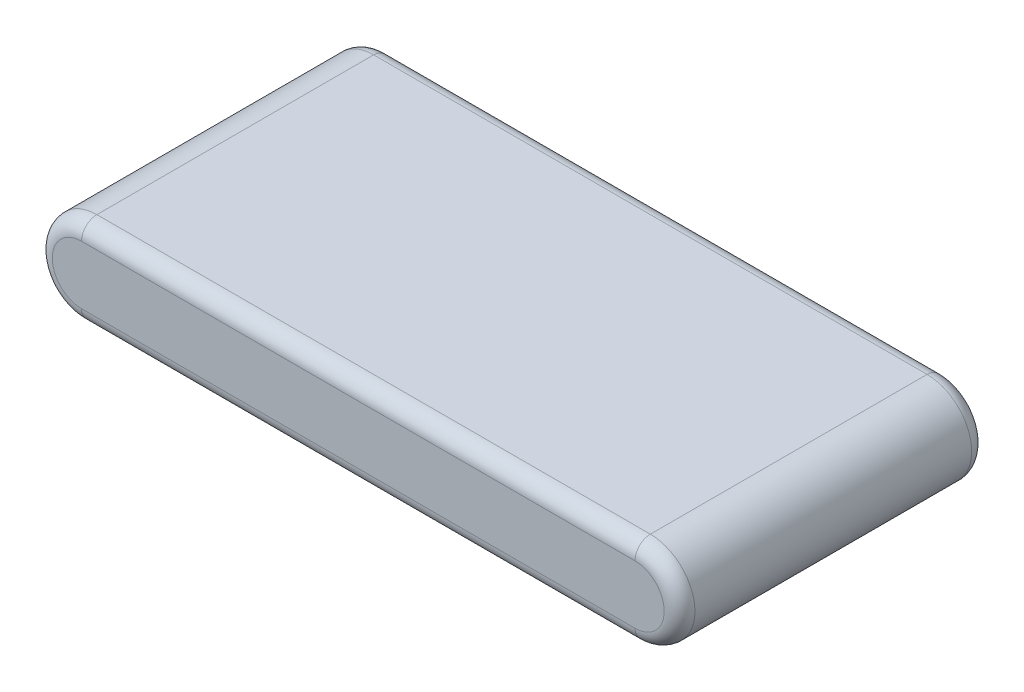
from build123d import *

# Parameters (mm, degrees)
RESSALTO_EXTRUS_O1_DEPTH = 10
FILETE1_R                = 0.5


with BuildPart() as part:
    # Esboço1 → Ressalto-extrusão1 (new body)
    with BuildSketch(Plane.XY):
        with BuildLine():
            Line((9, 1.45), (-9, 1.45))
            ThreePointArc((-9, 1.45), (-10.45, 0), (-9, -1.45))
            Line((-9, -1.45), (9, -1.45))
            ThreePointArc((9, -1.45), (10.45, 0), (9, 1.45))
        make_face()
    extrude(amount=RESSALTO_EXTRUS_O1_DEPTH)

    # Filete1
    filete1_edges = [part.edges().sort_by_distance(p)[0] for p in [
        (0, 1.45, 0),
        (-10.45, 0, 0),
        (0, -1.45, 0),
        (10.45, 0, 0),
        (0, -1.45, 10),
        (-10.45, 0, 10),
        (0, 1.45, 10),
        (10.45, 0, 10),
    ]]
    fillet(filete1_edges, radius=FILETE1_R)


solid = part.part
